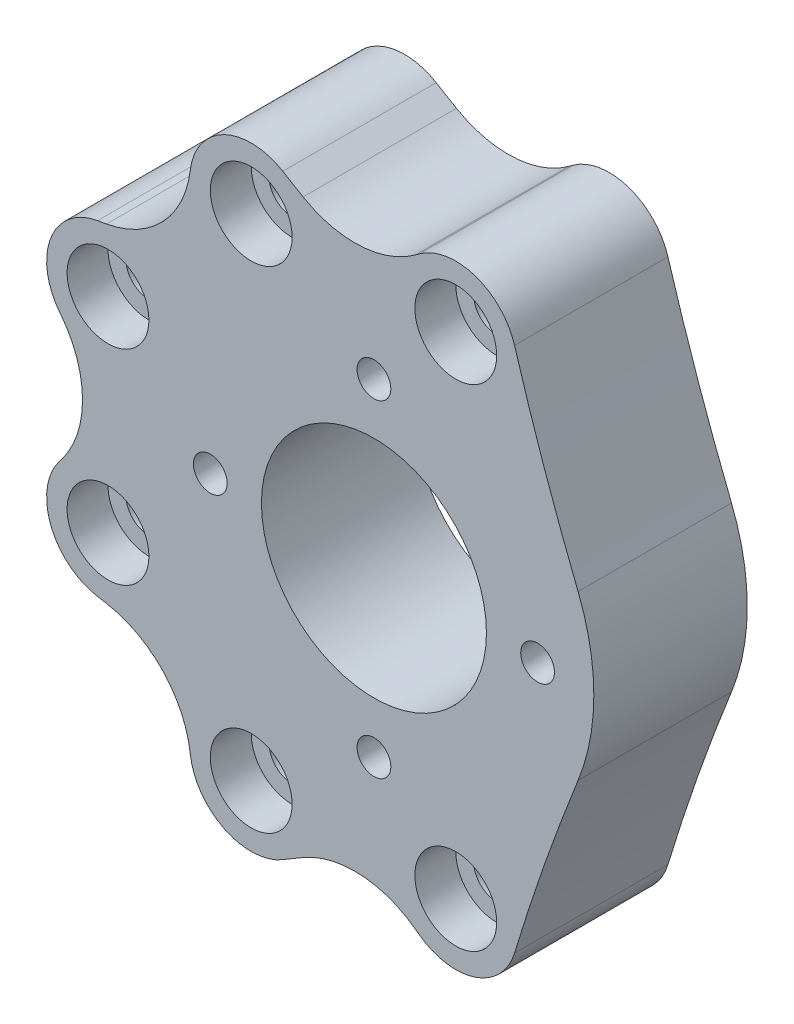
from build123d import *

# Parameters (mm, degrees)
SKETCH1_R                      = 21.5
BOSS_EXTRUDE1_DEPTH            = 15
TAP_DRILL_FOR_M4X0_7_TAP1_D    = 3.3
BOSS_EXTRUDE2_DEPTH            = 15
SKETCH6_R                      = 11
CUT_EXTRUDE1_DEPTH             = 47.357307946
FILLET1_DEPTH                  = 15
FILLET2_R                      = 10
CBORE_FOR_M4_SHCS2_D           = 4.5
CBORE_FOR_M4_SHCS2_CBORE_D     = 8
CBORE_FOR_M4_SHCS2_CBORE_DEPTH = 4


with BuildPart() as part:
    # Sketch1 → Boss-Extrude1 (new body)
    with BuildSketch(Plane.XY):
        Circle(SKETCH1_R)
    extrude(amount=BOSS_EXTRUDE1_DEPTH)

    # Tap Drill for M4x0.7 Tap1 (through all)
    with Locations(Plane(origin=(0, 0, 0), x_dir=(-1, 0, 0), z_dir=(0, 0, -1))):
        with Locations((0, 16), (16, 0), (0, -16), (-16, 0)):
            Hole(TAP_DRILL_FOR_M4X0_7_TAP1_D / 2)

    # Sketch3 → Boss-Extrude2 (add)
    with BuildSketch(Plane(origin=(0, 0, 0), x_dir=(-1, 0, 0), z_dir=(0, 0, -1))):
        with BuildLine():
            Line((-2.307900214, 25.897366597), (-0.836682642, 21.483713882))
            ThreePointArc((-0.836682642, 21.483713882), (-6.798896971, 20.396690908), (-12.220882218, 17.688980689))
            Line((-12.220882218, 17.688980689), (-13.69209979, 22.102633403))
            ThreePointArc((-13.69209979, 22.102633403), (-9.897366599, 29.692099788), (-2.307900214, 25.897366597))
        make_face()
        with BuildLine():
            Line((17.366563149, 21.316718426), (14.599655804, 15.782903738))
            ThreePointArc((14.599655804, 15.782903738), (9.615092305, 19.230184606), (3.866529512, 21.149466885))
            Line((3.866529512, 21.149466885), (6.633436857, 26.683281574))
            ThreePointArc((6.633436857, 26.683281574), (14.683281576, 29.366563146), (17.366563149, 21.316718426))
        make_face()
        with BuildLine():
            Line((23.846125524, 15.600073637), (17.115813542, 13.011492105))
            ThreePointArc((17.115813542, 13.011492105), (20.066930533, 7.718050205), (21.423562493, 1.811344831))
            Line((21.423562493, 1.811344831), (28.153874476, 4.399926363))
            ThreePointArc((28.153874476, 4.399926363), (31.600073637, 12.153874476), (23.846125524, 15.600073637))
        make_face()
        with BuildLine():
            Line((23.846125524, -15.600073637), (17.115813542, -13.011492105))
            ThreePointArc((17.115813542, -13.011492105), (20.066930533, -7.718050205), (21.423562493, -1.811344831))
            Line((21.423562493, -1.811344831), (28.153874476, -4.399926363))
            ThreePointArc((28.153874476, -4.399926363), (31.600073637, -12.153874476), (23.846125524, -15.600073637))
        make_face()
        with BuildLine():
            Line((17.366563149, -21.316718426), (14.599655804, -15.782903738))
            ThreePointArc((14.599655804, -15.782903738), (9.615092305, -19.230184606), (3.866529512, -21.149466885))
            Line((3.866529512, -21.149466885), (6.633436857, -26.683281574))
            ThreePointArc((6.633436857, -26.683281574), (14.683281576, -29.366563146), (17.366563149, -21.316718426))
        make_face()
        with BuildLine():
            Line((-2.307900214, -25.897366597), (-0.836682642, -21.483713882))
            ThreePointArc((-0.836682642, -21.483713882), (-6.798896971, -20.396690908), (-12.220882218, -17.688980689))
            Line((-12.220882218, -17.688980689), (-13.69209979, -22.102633403))
            ThreePointArc((-13.69209979, -22.102633403), (-9.897366599, -29.692099788), (-2.307900214, -25.897366597))
        make_face()
    extrude(amount=-BOSS_EXTRUDE2_DEPTH)

    # Sketch6 → Cut-Extrude1 (cut, through all)
    with BuildSketch(Plane(origin=(0, 0, 0), x_dir=(-1, 0, 0), z_dir=(0, 0, -1))):
        Circle(SKETCH6_R)
    extrude(amount=-CUT_EXTRUDE1_DEPTH, mode=Mode.SUBTRACT)

    # Fillet1: read off the stored shape, not the designer's step
    # Fillet1 outline → Fillet1 (add)
    with BuildSketch(Plane.XY):
        with BuildLine():
            ThreePointArc((13.744239295, -25.733122887), (16.656803279, -16.794634864), (19.959130827, -7.9926902))
            ThreePointArc((19.959130827, -7.9926902), (16.804547664, -13.411084139), (12.220882218, -17.688980689))
            Line((12.220882218, -17.688980689), (13.69209979, -22.102633403))
            ThreePointArc((13.69209979, -22.102633403), (13.999381334, -23.913839504), (13.744239295, -25.733122887))
        make_face()
        with BuildLine():
            ThreePointArc((12.220882218, 17.688980689), (16.804547664, 13.411084139), (19.959130827, 7.9926902))
            ThreePointArc((19.959130827, 7.9926902), (16.656803279, 16.794634864), (13.744239295, 25.733122887))
            ThreePointArc((13.744239295, 25.733122887), (13.999381334, 23.913839504), (13.69209979, 22.102633403))
            Line((13.69209979, 22.102633403), (12.220882218, 17.688980689))
        make_face()
        with BuildLine():
            ThreePointArc((-1.269568391, -24.771937297), (1.604087257, -26.779090443), (4.4444823, -28.833041886))
            ThreePointArc((4.4444823, -28.833041886), (3.148798639, -27.530700404), (2.307900214, -25.897366597))
            Line((2.307900214, -25.897366597), (0.836682642, -21.483713882))
            ThreePointArc((0.836682642, -21.483713882), (-1.524113932, -21.445910489), (-3.866529512, -21.149466885))
            Line((-3.866529512, -21.149466885), (-6.633436857, -26.683281574))
            ThreePointArc((-6.633436857, -26.683281574), (-7.59800708, -28.077064913), (-8.913884182, -29.145472684))
            ThreePointArc((-8.913884182, -29.145472684), (-5.114227359, -26.919376327), (-1.269568391, -24.771937297))
        make_face()
        with BuildLine():
            ThreePointArc((2.307900214, 25.897366597), (3.148798639, 27.530700404), (4.4444823, 28.833041886))
            ThreePointArc((4.4444823, 28.833041886), (1.604087257, 26.779090443), (-1.269568391, 24.771937297))
            ThreePointArc((-1.269568391, 24.771937297), (-5.114227359, 26.919376327), (-8.913884182, 29.145472684))
            ThreePointArc((-8.913884182, 29.145472684), (-7.59800708, 28.077064913), (-6.633436857, 26.683281574))
            Line((-6.633436857, 26.683281574), (-3.866529512, 21.149466885))
            ThreePointArc((-3.866529512, 21.149466885), (-1.524113932, 21.445910489), (0.836682642, 21.483713882))
            Line((0.836682642, 21.483713882), (2.307900214, 25.897366597))
        make_face()
        with BuildLine():
            ThreePointArc((-18.827219, -17.493972554), (-18.367768434, -21.052580188), (-17.968047643, -24.618390952))
            ThreePointArc((-17.968047643, -24.618390952), (-17.902847687, -22.924644608), (-17.366563149, -21.316718426))
            Line((-17.366563149, -21.316718426), (-14.599655804, -15.782903738))
            ThreePointArc((-14.599655804, -15.782903738), (-15.918163511, -14.452061114), (-17.115813542, -13.011492105))
            Line((-17.115813542, -13.011492105), (-23.846125524, -15.600073637))
            ThreePointArc((-23.846125524, -15.600073637), (-25.412904992, -15.971207537), (-27.021964079, -15.912325213))
            ThreePointArc((-27.021964079, -15.912325213), (-22.91688029, -16.663195777), (-18.827219, -17.493972554))
        make_face()
        with BuildLine():
            ThreePointArc((-17.366563149, 21.316718426), (-17.902847687, 22.924644608), (-17.968047643, 24.618390952))
            ThreePointArc((-17.968047643, 24.618390952), (-18.367768434, 21.052580188), (-18.827219, 17.493972554))
            ThreePointArc((-18.827219, 17.493972554), (-22.91688029, 16.663195777), (-27.021964079, 15.912325213))
            ThreePointArc((-27.021964079, 15.912325213), (-25.412904992, 15.971207537), (-23.846125524, 15.600073637))
            Line((-23.846125524, 15.600073637), (-17.115813542, 13.011492105))
            ThreePointArc((-17.115813542, 13.011492105), (-15.918163511, 14.452061114), (-14.599655804, 15.782903738))
            Line((-14.599655804, 15.782903738), (-17.366563149, 21.316718426))
        make_face()
        with BuildLine():
            ThreePointArc((-25.965184624, 0), (-28.313790974, -3.170063395), (-30.720438686, -6.296291235))
            ThreePointArc((-30.720438686, -6.296291235), (-29.565542777, -5.174349297), (-28.153874476, -4.399926363))
            Line((-28.153874476, -4.399926363), (-21.423562493, -1.811344831))
            ThreePointArc((-21.423562493, -1.811344831), (-21.5, 0), (-21.423562493, 1.811344831))
            Line((-21.423562493, 1.811344831), (-28.153874476, 4.399926363))
            ThreePointArc((-28.153874476, 4.399926363), (-29.565542777, 5.174349297), (-30.720438686, 6.296291235))
            ThreePointArc((-30.720438686, 6.296291235), (-28.313790974, 3.170063395), (-25.965184624, 0))
        make_face()
    extrude(amount=FILLET1_DEPTH)

    # Fillet2
    fillet2_edges = [part.edges().sort_by_distance(p)[0] for p in [
        (-1.269568391, -24.771937297, 7.5),
        (-18.827219, -17.493972554, 7.5),
        (-25.965184624, 0, 7.5),
        (-18.827219, 17.493972554, 7.5),
        (-1.269568391, 24.771937297, 7.5),
    ]]
    fillet(fillet2_edges, radius=FILLET2_R)

    # CBORE for M4 SHCS2 (through all)
    with Locations(Plane.XY.offset(15)):
        with Locations((8.000000002, 24), (-12.000000003, 24), (-26, 10), (-26, -10), (-12.000000003, -24), (8.000000002, -24)):
            CounterBoreHole(CBORE_FOR_M4_SHCS2_D / 2, CBORE_FOR_M4_SHCS2_CBORE_D / 2, CBORE_FOR_M4_SHCS2_CBORE_DEPTH)


solid = part.part
